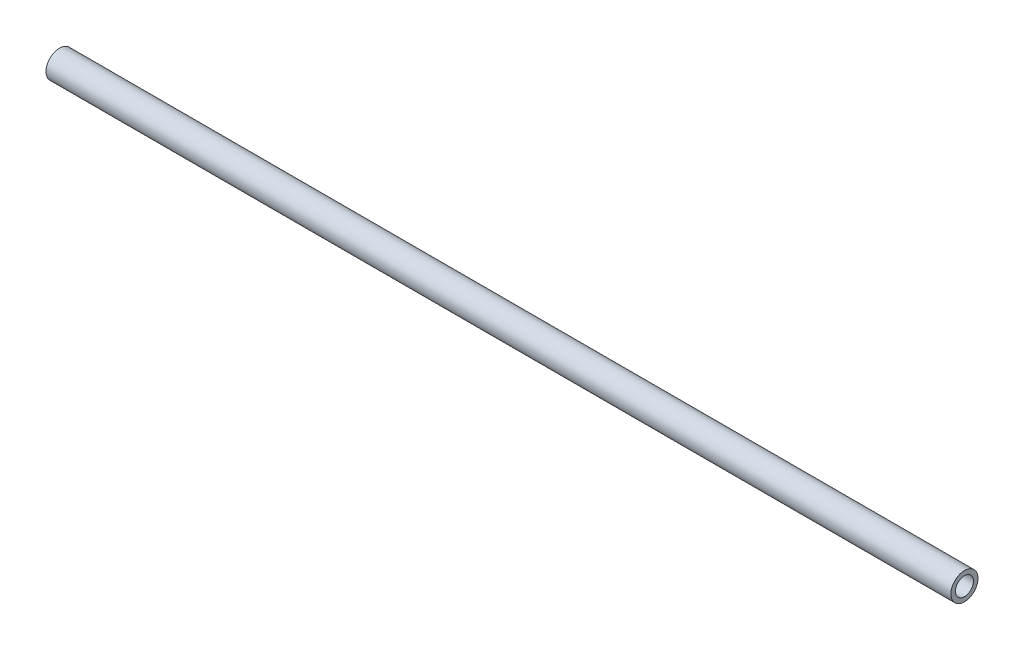
from build123d import *

# Parameters (mm, degrees)
SKETCH3_R           = 9.525
SKETCH3_R_2         = 6.35
BOSS_EXTRUDE1_DEPTH = 317.5


with BuildPart() as part:
    # Sketch3 → Boss-Extrude1 (new, symmetric)
    with BuildSketch(Plane(origin=(0, 0, 0), x_dir=(0, 0, -1), z_dir=(1, 0, 0))):
        Circle(SKETCH3_R)
        Circle(SKETCH3_R_2, mode=Mode.SUBTRACT)
    extrude(amount=BOSS_EXTRUDE1_DEPTH, both=True)


solid = part.part
